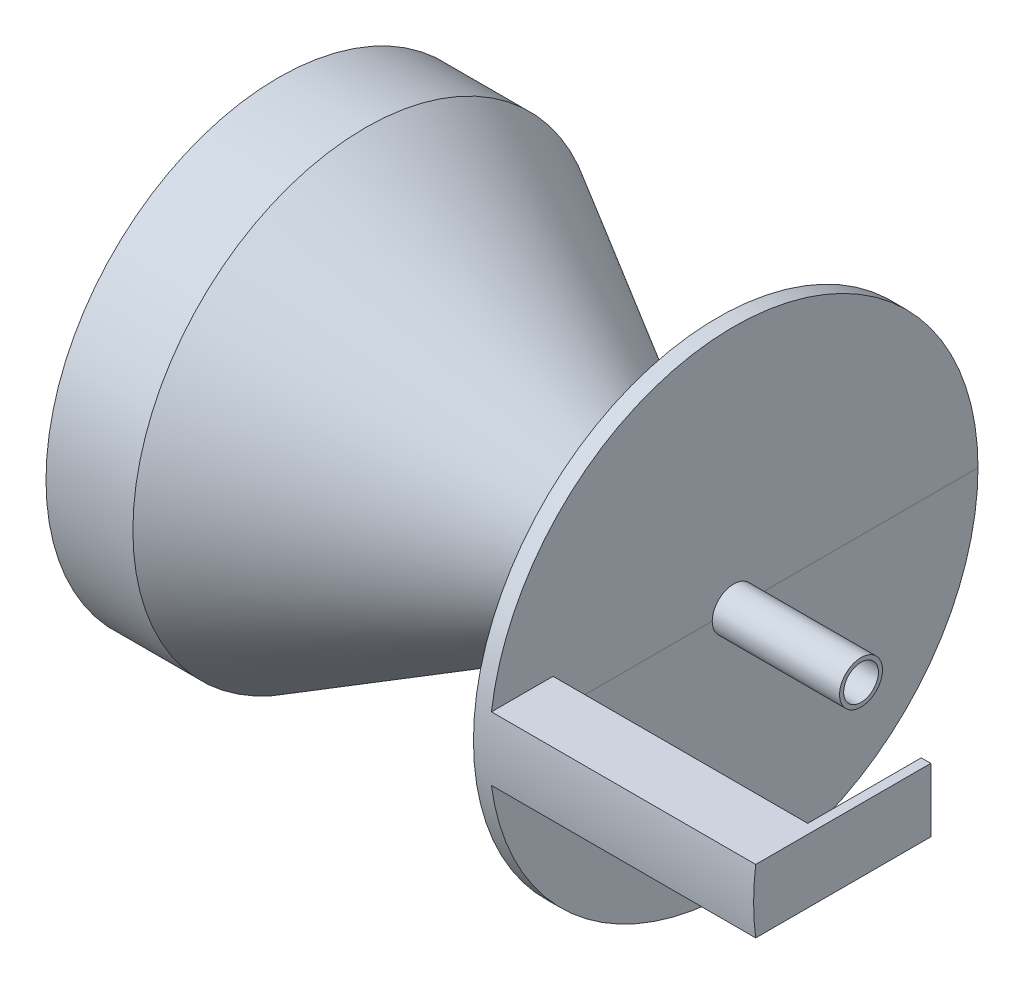
from build123d import *

# Parameters (mm, degrees)
SHELL_1_T                = 3
SKETCH_4_R               = 5.381890803
CUT_EXTRUDE_2_DEPTH      = 10
SWEEP_START              = 143
SWEEP_2_OUTLINE_R        = 6.739132173
SWEEP_2_DEPTH            = 40
SKETCH_7_R               = 5.459251346
CUT_EXTRUDE_3_DEPTH      = 40
EXTRUDE_5_DEPTH          = 80
CUT_EXTRUDE_4_DEPTH      = 10
CUT_EXTRUDE_4_DEPTH_BACK = 90
SKETCH_12_R              = 8.615934325
EXTRUDE_6_DEPTH          = 3


# Read off the part's stored shape, not the designer's step: 扫描2
with BuildPart() as part:
    # 草图1 → 旋转1 (revolve)
    with BuildSketch(Plane(origin=(0, 0, 0), x_dir=(1, 0, 0), z_dir=(0, 1, 0)), mode=Mode.PRIVATE) as revolve_1_sk:
        Polygon((0, 0), (140, 0), (140, 5), (26.491388223, 70), (0, 70), align=None)
    revolve(revolve_1_sk.sketch.rotate(Axis((0, 0, 0), (1, 0, 0)), 180), axis=Axis((0, 0, 0), (1, 0, 0)))

    # 抽壳1
    shell_1_openings = [part.faces().sort_by_distance(p)[0] for p in [
        (0, 0, 0),
    ]]
    offset(amount=SHELL_1_T, openings=shell_1_openings, kind=Kind.INTERSECTION)

    # 草图4 → 切除-拉伸2 (cut)
    with BuildSketch(Plane(origin=(143, 0, 0), x_dir=(0, 0, -1), z_dir=(1, 0, 0))):
        Circle(SKETCH_4_R)
    extrude(amount=-CUT_EXTRUDE_2_DEPTH, mode=Mode.SUBTRACT)

    # 扫描2 outline → 扫描2 (add)
    with BuildSketch(Plane.YZ.offset(SWEEP_START)):
        Circle(SWEEP_2_OUTLINE_R)
    extrude(amount=SWEEP_2_DEPTH)

    # 草图7 → 切除-拉伸3 (cut)
    with BuildSketch(Plane(origin=(143, 0, 0), x_dir=(0, 0, -1), z_dir=(1, 0, 0))):
        Circle(SKETCH_7_R)
    extrude(amount=CUT_EXTRUDE_3_DEPTH, mode=Mode.SUBTRACT)

    # 扫描3: sweep along a curve in space
    with BuildLine() as sweep_3_path:
        ThreePointArc((143, 0, 6.739132173), (143, 4.765286059, 4.765286059), (143, 6.739132173, 0))
        ThreePointArc((143, 6.739132173, 0), (143, 4.765286059, -4.765286059), (143, 0, -6.739132173))
        ThreePointArc((143, 0, -6.739132173), (143, -4.765286059, -4.765286059), (143, -6.739132173, 0))
        ThreePointArc((143, -6.739132173, 0), (143, -4.765286059, 4.765286059), (143, 0, 6.739132173))
    # 草图9 → 扫描3 (sweep)
    with BuildSketch(Plane(origin=(0, 0, 0), x_dir=(1, 0, 0), z_dir=(0, 1, 0))):
        Polygon((143, 6.739132173), (143, 76.739132173), (138, 76.739132173), (138, 9.602351051), align=None)
    sweep(path=sweep_3_path.line)

    # 草图10 → 凸台-拉伸5 (add)
    with BuildSketch(Plane(origin=(143, 0, 0), x_dir=(0, 0, -1), z_dir=(1, 0, 0))):
        with BuildLine():
            Line((-56.739132173, 0), (-56.739132173, 10))
            Line((-56.739132173, 10), (-76.084784331, 10))
            ThreePointArc((-76.084784331, 10), (-76.739132173, 0), (-76.084784331, -10))
            Line((-76.084784331, -10), (-56.739132173, -10))
            Line((-56.739132173, -10), (-56.739132173, 0))
        make_face()
    extrude(amount=EXTRUDE_5_DEPTH)

    # 草图12 → 切除-拉伸4 (cut, two sides: drawn at the far end of the back side and taken through both)
    with BuildSketch(Plane(origin=(223, 0, 0), x_dir=(0, 0, -1), z_dir=(1, 0, 0)).offset(-CUT_EXTRUDE_4_DEPTH_BACK)):
        with Locations((-67.05739748, 0)):
            Circle(SKETCH_12_R)
    extrude(amount=CUT_EXTRUDE_4_DEPTH + CUT_EXTRUDE_4_DEPTH_BACK, mode=Mode.SUBTRACT)

    # 草图11 → 凸台-拉伸6 (add)
    with BuildSketch(Plane(origin=(223, 0, 0), x_dir=(0, 0, -1), z_dir=(1, 0, 0))):
        with BuildLine():
            Line((-76.084784331, 10), (-21.084784331, 10))
            Line((-21.084784331, 10), (-21.084784331, -10))
            Line((-21.084784331, -10), (-76.084784331, -10))
            ThreePointArc((-76.084784331, -10), (-76.739132173, 0), (-76.084784331, 10))
        make_face()
    extrude(amount=EXTRUDE_6_DEPTH)


solid = part.part
